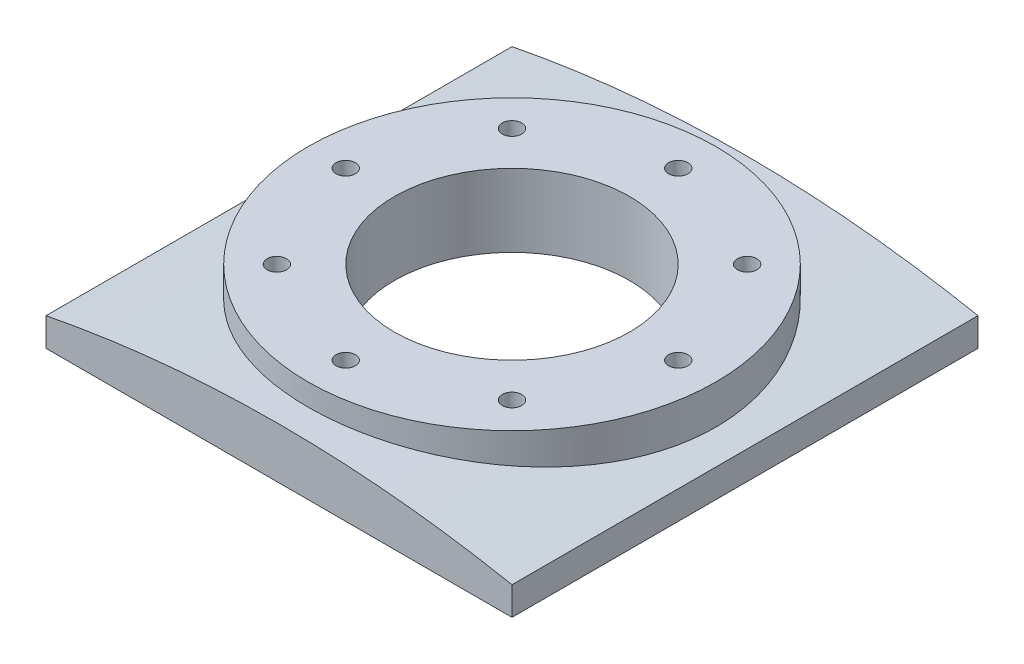
from build123d import *

# Parameters (mm, degrees)
SKETCH1_W           = 203.2
SKETCH1_H           = 203.2
BOSS_EXTRUDE1_DEPTH = 22.225
CUT_EXTRUDE1_START  = -203.2
CUT_EXTRUDE1_DEPTH  = 203.2
SKETCH3_R           = 88.9
BOSS_EXTRUDE2_DEPTH = 31.75
SKETCH4_R           = 51.25
CUT_EXTRUDE2_DEPTH  = 290.116832062
CIRPATTERN1_COUNT   = 8
CIRPATTERN2_COUNT   = 8


# Read off the part's stored shape, not the designer's step: Cut-Extrude1
with BuildPart() as part:
    # Sketch1 → Boss-Extrude1 (new body)
    with BuildSketch(Plane(origin=(0, 0, 0), x_dir=(1, 0, 0), z_dir=(0, 1, 0))):
        with Locations((101.6, 101.6)):
            Rectangle(SKETCH1_W, SKETCH1_H)
    extrude(amount=BOSS_EXTRUDE1_DEPTH)

    # Cut-Extrude1 outline → Cut-Extrude1 (cut)
    with BuildSketch(Plane.XY.offset(CUT_EXTRUDE1_START)):
        with BuildLine():
            ThreePointArc((0, 12.339521695), (50.560108139, 19.747808997), (101.600002148, 22.225))
            Line((101.600002148, 22.225), (0, 22.225))
            Line((0, 22.225), (0, 12.339521695))
        make_face()
        with BuildLine():
            ThreePointArc((101.600002148, 22.225), (152.639893999, 19.747808789), (203.2, 12.339521695))
            Line((203.2, 12.339521695), (203.2, 22.225))
            Line((203.2, 22.225), (101.600002148, 22.225))
        make_face()
    extrude(amount=CUT_EXTRUDE1_DEPTH, mode=Mode.SUBTRACT)

    # Sketch3 → Boss-Extrude2 (add)
    with BuildSketch(Plane(origin=(0, 0, 0), x_dir=(-1, 0, 0), z_dir=(0, -1, 0))):
        with Locations(Location((-101.6, 101.6, 0), (0, 0, 90))):
            Circle(SKETCH3_R)
    extrude(amount=-BOSS_EXTRUDE2_DEPTH)

    # Sketch4 → Cut-Extrude2 (cut, through all)
    with BuildSketch(Plane(origin=(0, 31.75, 0), x_dir=(1, 0, 0), z_dir=(0, 1, 0))):
        with Locations(Location((101.6, 101.6, 0), (0, 0, 270))):
            Circle(SKETCH4_R)
    extrude(amount=-CUT_EXTRUDE2_DEPTH, mode=Mode.SUBTRACT)

    # Sketch6 → Tapped Hole for 5/16-18 Helicoil1 (revolve, cut)
    with BuildSketch(Plane(origin=(101.6, 31.75, -174.1), x_dir=(0, 0, 1), z_dir=(1, 0, 0))):
        Polygon((0, 0), (0, 22.878868714), (4.2164, 20.3454), (4.2164, 0), align=None)
    tapped_hole_for_5_16_18_helicoil1 = revolve(axis=Axis((101.6, 38.1, -174.1), (0, -1, 0)), mode=Mode.SUBTRACT)

    # CirPattern1: Tapped Hole for 5/16-18 Helicoil1 ×8 about axis
    cirpattern1_axis = Axis((101.6, 0, -101.6), (0, 1, 0))
    for i in range(1, CIRPATTERN1_COUNT):
        add(tapped_hole_for_5_16_18_helicoil1.rotate(cirpattern1_axis, i * 360 / CIRPATTERN1_COUNT), mode=Mode.SUBTRACT)

    # Sketch13 → Tapped Hole for 5/16-18 Helicoil2 (revolve, cut)
    with BuildSketch(Plane(origin=(129.344548846, 0, -34.618733893), x_dir=(0, 0, -1), z_dir=(1, 0, 0))):
        Polygon((0, 0), (0, 22.878868714), (4.2164, 20.3454), (4.2164, 0), align=None)
    tapped_hole_for_5_16_18_helicoil2 = revolve(axis=Axis((129.344548846, -6.35, -34.618733893), (0, 1, 0)), mode=Mode.SUBTRACT)

    # CirPattern2: Tapped Hole for 5/16-18 Helicoil2 ×8 about axis
    cirpattern2_axis = Axis((101.6, 0, -101.6), (0, 1, 0))
    for i in range(1, CIRPATTERN2_COUNT):
        add(tapped_hole_for_5_16_18_helicoil2.rotate(cirpattern2_axis, i * 360 / CIRPATTERN2_COUNT), mode=Mode.SUBTRACT)


solid = part.part
